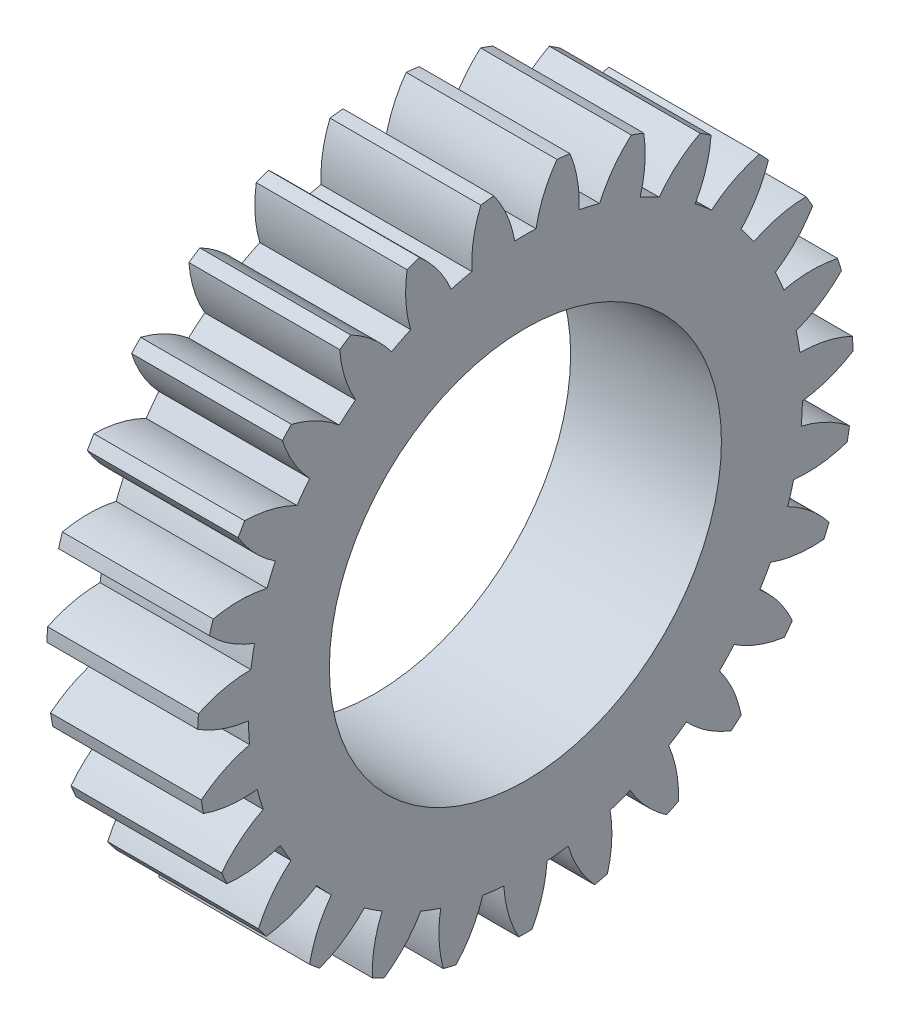
from build123d import *

# Parameters (mm, degrees)
BASPROSKE_W     = 10
BASPROSKE_H     = 21.75
TOOTHCUT_DEPTH  = 33.343855676
TEETHCUTS_COUNT = 27
TEETHCUTS_ANGLE = 346.666666667
BORSKE_R        = 13
BORE_DEPTH      = 50.0000508


with BuildPart() as part:
    # BasProSke → Base-Revolve (revolve)
    with BuildSketch(Plane(origin=(0, 0, 0), x_dir=(1, 0, 0), z_dir=(0, 1, 0))):
        with Locations((5, 10.875)):
            Rectangle(BASPROSKE_W, BASPROSKE_H)
    revolve(axis=Axis((-10, 0, 0), (1, 0, 0)))

    # TooCutSke → ToothCut (cut, through all)
    with BuildSketch(Plane(origin=(0, 0, 0), x_dir=(0, 0, -1), z_dir=(1, 0, 0))):
        with BuildLine():
            ThreePointArc((0.704815466, 18.360476877), (0, 18.374), (-0.704815466, 18.360476877))
            ThreePointArc((-0.704815466, 18.360476877), (-1.220614561, 20.095701504), (-2.108907523, 21.673037494))
            ThreePointArc((-2.108907523, 21.673037494), (0, 21.7754), (2.108907523, 21.673037494))
            ThreePointArc((2.108907523, 21.673037494), (1.220614561, 20.095701504), (0.704815466, 18.360476877))
        make_face()
    toothcut = extrude(amount=TOOTHCUT_DEPTH, mode=Mode.SUBTRACT)

    # TeethCuts: ToothCut ×27 about axis
    teethcuts_axis = Axis((-10, 0, 0), (1, 0, 0))
    for i in range(1, TEETHCUTS_COUNT):
        add(toothcut.rotate(teethcuts_axis, i * TEETHCUTS_ANGLE / (TEETHCUTS_COUNT - 1)), mode=Mode.SUBTRACT)

    # BorSke → Bore (cut, symmetric)
    with BuildSketch(Plane(origin=(0, 0, 0), x_dir=(0, 0, -1), z_dir=(1, 0, 0))):
        Circle(BORSKE_R)
    extrude(amount=BORE_DEPTH, both=True, mode=Mode.SUBTRACT)


solid = part.part
